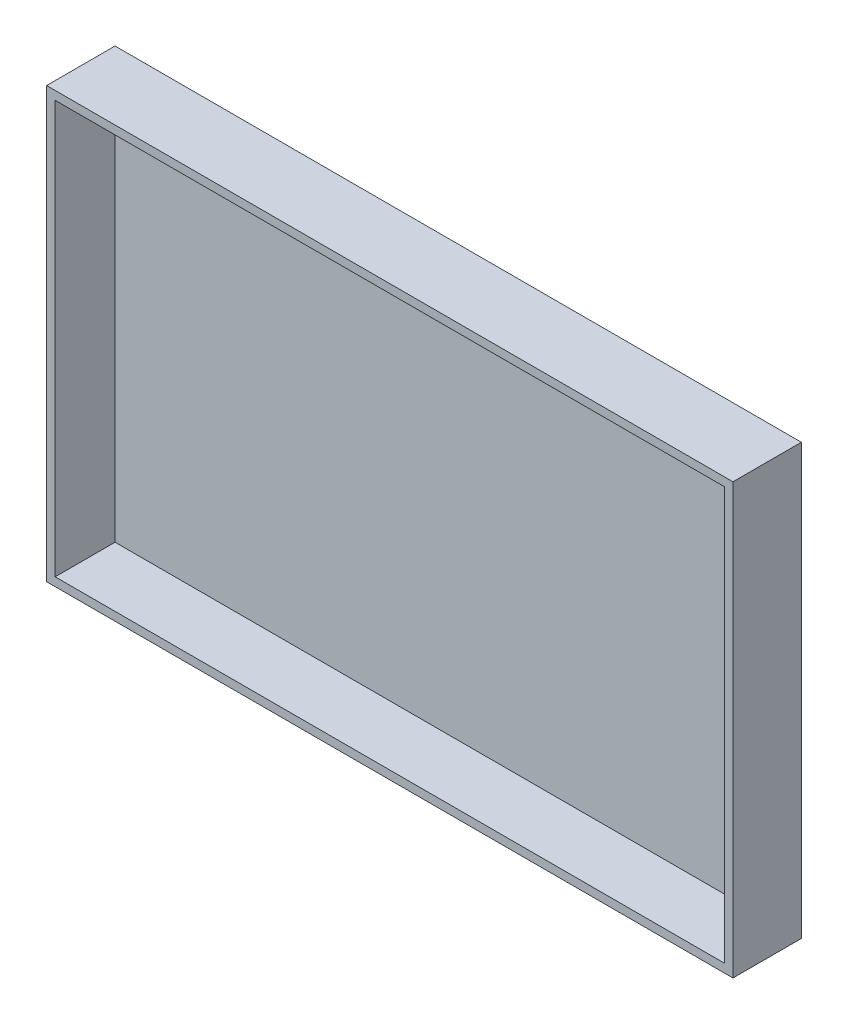
from build123d import *

# Parameters (mm, degrees)
ESQUISSE1_W        = 160.5
ESQUISSE1_H        = 100.5
BOSS_EXTRU_1_DEPTH = 2
ESQUISSE2_W        = 160.5
ESQUISSE2_H        = 100.5
ESQUISSE2_W_2      = 156.5
ESQUISSE2_H_2      = 96.5
BOSS_EXTRU_2_DEPTH = 14


with BuildPart() as part:
    # Esquisse1 → Boss.-Extru.1 (new body)
    with BuildSketch(Plane.XY):
        with Locations((29.111896839, -20.03202995)):
            Rectangle(ESQUISSE1_W, ESQUISSE1_H)
    extrude(amount=BOSS_EXTRU_1_DEPTH)

    # Esquisse2 → Boss.-Extru.2 (add)
    with BuildSketch(Plane.XY.offset(2)):
        with Locations((29.111896839, -20.03202995)):
            Rectangle(ESQUISSE2_W, ESQUISSE2_H)
        with Locations((29.111896839, -20.03202995)):
            Rectangle(ESQUISSE2_W_2, ESQUISSE2_H_2, mode=Mode.SUBTRACT)
    extrude(amount=BOSS_EXTRU_2_DEPTH)


solid = part.part
